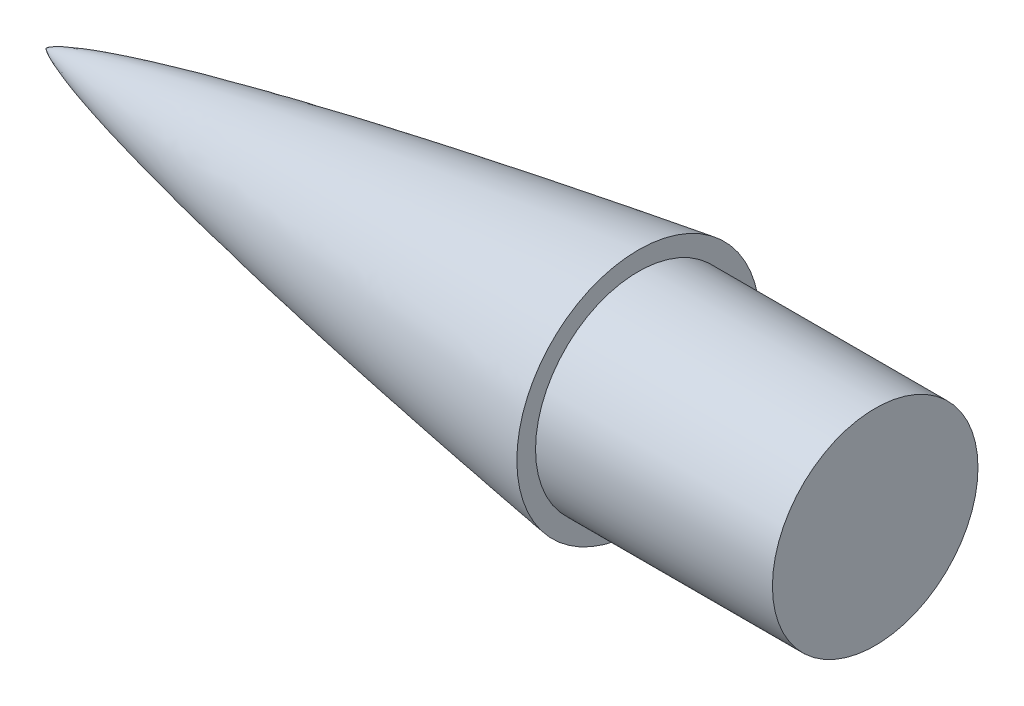
from build123d import *

# Parameters (mm, degrees)
SKETCH2_R           = 11.021474984
BOSS_EXTRUDE1_DEPTH = 25.4


with BuildPart() as part:
    # Sketch1 → Revolve1 (revolve)
    with BuildSketch(Plane.XY):
        with BuildLine():
            Line((0, 0), (63.5, 0))
            Line((63.5, 0), (63.5, 13.028074984))
            add(Edge.make_bspline(
                [(0, 0), (0.002336833, 0.006261243), (0.008449108, 0.018018878), (0.024282699, 0.03707865), (0.049301381, 0.062528261), (0.08285746, 0.091694078), (0.130092662, 0.128429562), (0.198903613, 0.176633842), (0.30891132, 0.245881724), (0.489853363, 0.347787552), (0.801272327, 0.503404043), (1.344136271, 0.742812456), (2.303049814, 1.112670534), (3.919864292, 1.656956496), (6.546639289, 2.429833778), (10.068878534, 3.343191013), (14.305527269, 4.334349194), (18.946313889, 5.336202581), (23.628097401, 6.283524727), (28.273967135, 7.178106017), (32.999382683, 8.046293889), (37.611964806, 8.865298109), (42.423650353, 9.686589349), (46.919606109, 10.436239642), (51.945798569, 11.244109234), (56.103593098, 11.902196623), (60.304657925, 12.545344223), (62.429235615, 12.867169996), (63.5, 13.028074984)],
                knots=[0, 0, 0, 0, 0, 0.000372793, 0.000745586, 0.001374859, 0.002003335, 0.00285942, 0.004097636, 0.006081541, 0.009280173, 0.014497358, 0.02358268, 0.039337108, 0.06679986, 0.110142427, 0.176804124, 0.243465828, 0.310127525, 0.376789225, 0.443450925, 0.510112626, 0.576774327, 0.643436027, 0.710097727, 0.776759427, 0.843421128, 0.910082828, 0.910082828, 0.910082828, 0.910082828, 0.910082828], degree=4))
        make_face()
    revolve(axis=Axis((0, 0, 0), (1, 0, 0)))

    # Sketch2 → Boss-Extrude1 (add)
    with BuildSketch(Plane(origin=(63.5, 0, 0), x_dir=(0, 0, -1), z_dir=(1, 0, 0))):
        Circle(SKETCH2_R)
    extrude(amount=BOSS_EXTRUDE1_DEPTH)


solid = part.part
